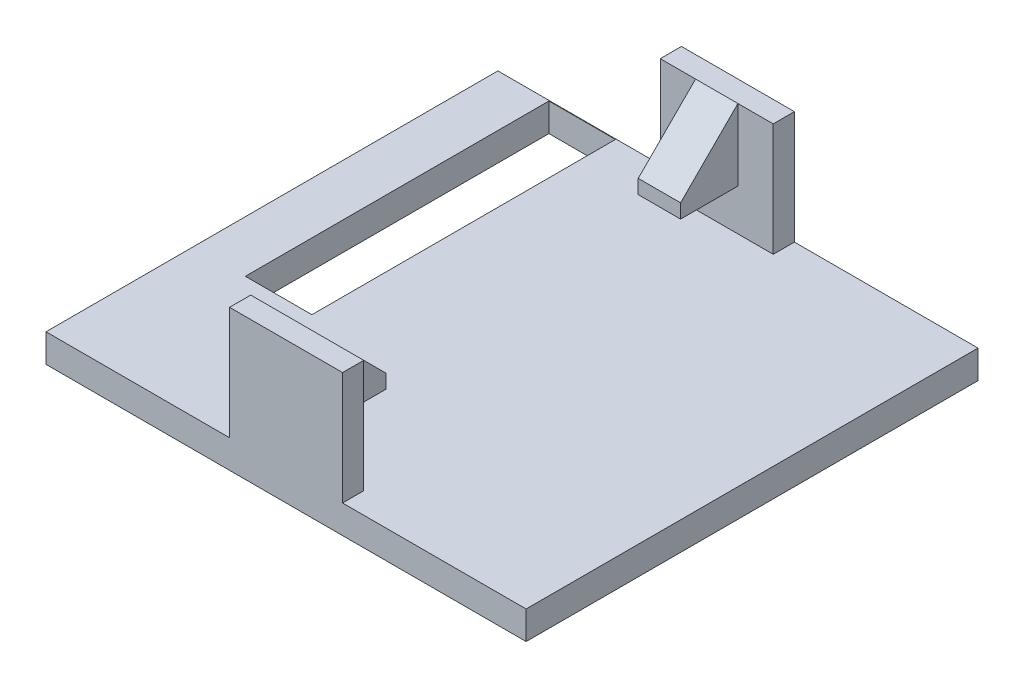
from build123d import *

# Parameters (mm, degrees)
SKETCH1_W           = 34
SKETCH1_H           = 32
BOSS_EXTRUDE1_DEPTH = 2
SKETCH4_W           = 4
SKETCH4_H           = 8
BOSS_EXTRUDE2_DEPTH = 1.5
BOSS_EXTRUDE5_DEPTH = 1.5
MIRROR1_START       = -4
MIRROR1_OUTLINE_W   = 8
MIRROR1_OUTLINE_H   = 1.5
MIRROR1_DEPTH       = 8
MIRROR1_START_2     = -1.5
MIRROR1_2_DEPTH     = 3
SKETCH7_W           = 4.713008878
SKETCH7_H           = 21.4981103
CUT_EXTRUDE1_DEPTH  = 7.5


# Read off the part's stored shape, not the designer's step: Mirror1
with BuildPart() as part:
    # Sketch1 → Boss-Extrude1 (new body)
    with BuildSketch(Plane(origin=(0, 0, 0), x_dir=(1, 0, 0), z_dir=(0, 1, 0))):
        Rectangle(SKETCH1_W, SKETCH1_H)
    extrude(amount=BOSS_EXTRUDE1_DEPTH)

    # Sketch4 → Boss-Extrude2 (add)
    with BuildSketch(Plane(origin=(0, 0, -16), x_dir=(-1, 0, 0), z_dir=(0, 0, -1))):
        with Locations((2, 6)):
            Rectangle(SKETCH4_W, SKETCH4_H)
    extrude(amount=-BOSS_EXTRUDE2_DEPTH)

    # Sketch5 → Boss-Extrude5 (add)
    with BuildSketch(Plane(origin=(0, 0, 0), x_dir=(0, 0, -1), z_dir=(1, 0, 0))):
        Polygon((14.5, 10), (10.439339828, 5.939339828), (10.439339828, 4.939339828), (14.5, 4.939339828), (14.5, 2), (16, 2), (16, 10), align=None)
    extrude(amount=-BOSS_EXTRUDE5_DEPTH)

    # Mirror1 outline → Mirror1 (add)
    with BuildSketch(Plane.YZ.offset(MIRROR1_START)):
        with Locations((6, 15.25)):
            Rectangle(MIRROR1_OUTLINE_W, MIRROR1_OUTLINE_H)
        with Locations((6, -15.25)):
            Rectangle(MIRROR1_OUTLINE_W, MIRROR1_OUTLINE_H)
    extrude(amount=MIRROR1_DEPTH)

    # Mirror1 2 outline → Mirror1 2 (add)
    with BuildSketch(Plane.YZ.offset(MIRROR1_START_2)):
        Polygon((4.939339828, -14.5), (10, -14.5), (5.939339828, -10.439339828), (4.939339828, -10.439339828), align=None)
        Polygon((10, 14.5), (4.939339828, 14.5), (4.939339828, 10.439339828), (5.939339828, 10.439339828), align=None)
    extrude(amount=MIRROR1_2_DEPTH)

    # Sketch7 → Cut-Extrude1 (cut)
    with BuildSketch(Plane(origin=(0, 2, 0), x_dir=(1, 0, 0), z_dir=(0, 1, 0))):
        with Locations((-10.988574464, 5.211128947)):
            Rectangle(SKETCH7_W, SKETCH7_H)
    extrude(amount=-CUT_EXTRUDE1_DEPTH, mode=Mode.SUBTRACT)


solid = part.part
